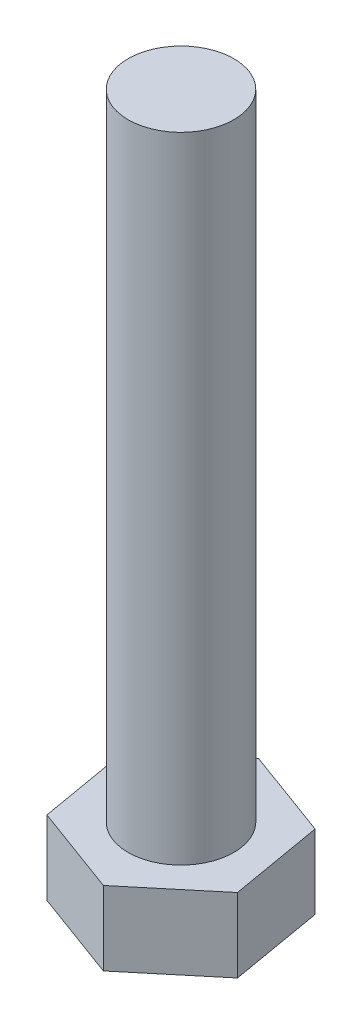
from build123d import *

# Parameters (mm, degrees)
EXTRUDE_1_DEPTH = 3.5
SKETCH_2_R      = 2.5
EXTRUDE_2_DEPTH = 30


with BuildPart() as part:
    # Эскиз1 → Вытянуть1 (new body)
    with BuildSketch(Plane(origin=(0, 0, 0), x_dir=(1, 0, 0), z_dir=(0, 1, 0))):
        Polygon((4.22329074, -1.553645816), (3.457142116, 2.88065416), (-0.766148625, 4.434299977), (-4.22329074, 1.553645816), (-3.457142116, -2.88065416), (0.766148625, -4.434299977), align=None)
    extrude(amount=EXTRUDE_1_DEPTH)

    # Эскиз2 → Вытянуть2 (add)
    with BuildSketch(Plane(origin=(0, 3.5, 0), x_dir=(1, 0, 0), z_dir=(0, 1, 0))):
        Circle(SKETCH_2_R)
    extrude(amount=EXTRUDE_2_DEPTH)


solid = part.part
